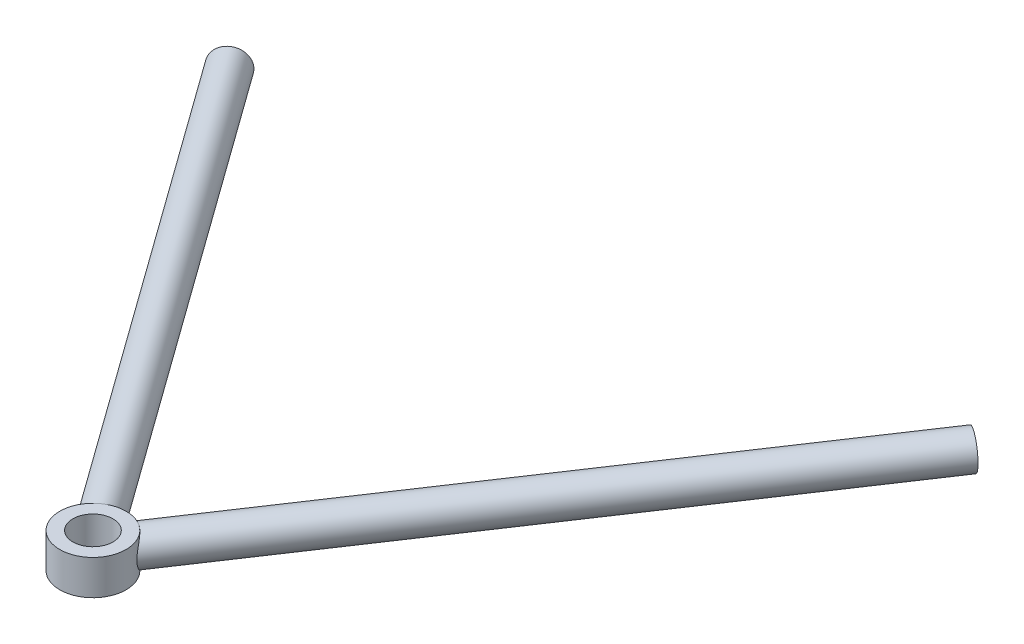
from build123d import *

# Parameters (mm, degrees)
SKETCH1_R                = 19.0062
SKETCH1_R_2              = 11.5062
BOSS_EXTRUDE1_DEPTH      = 10
BOSS_EXTRUDE2_REACH      = 392.082
SKETCH5_R                = 10
SKETCH5_R_2              = 7
BOSS_EXTRUDE3_REACH      = 510.057
BOSS_EXTRUDE3_END_RADIUS = 19.0062
SKETCH6_R                = 10
SKETCH6_R_2              = 7


with BuildPart() as part:
    # Sketch1 → Boss-Extrude1 (new, symmetric)
    with BuildSketch(Plane(origin=(0, 0, 0), x_dir=(1, 0, 0), z_dir=(0, 1, 0))):
        Circle(SKETCH1_R)
        Circle(SKETCH1_R_2, mode=Mode.SUBTRACT)
    extrude(amount=BOSS_EXTRUDE1_DEPTH, both=True)

    # Sketch5 → Boss-Extrude2 (add, up to next)
    with BuildSketch(Plane(origin=(201.884851726, 0, -302.352155823), x_dir=(0.8316479627965052, 0, 0.555303219850581), z_dir=(0.555303219850581, 0, -0.8316479627965052)), mode=Mode.PRIVATE) as boss_extrude2_sk1:
        Circle(SKETCH5_R)
        Circle(SKETCH5_R_2, mode=Mode.SUBTRACT)
    boss_extrude2_tool1 = extrude(boss_extrude2_sk1.sketch, amount=-BOSS_EXTRUDE2_REACH, mode=Mode.PRIVATE) - part.part
    add(boss_extrude2_tool1.solids().sort_by_distance((193.803598, 0, -307.748125))[0])

    # Boss-Extrude3: up to this cylinder (the profile starts outside it)
    boss_extrude3_end = Plane(origin=(0, 0, 0), z_dir=(0, -1, 0)) * Cylinder(BOSS_EXTRUDE3_END_RADIUS, 1059.1264, mode=Mode.PRIVATE)
    # Sketch6 → Boss-Extrude3 (add, up to the surface)
    with BuildSketch(Plane(origin=(-200.97050419, 0, -279.254437795), x_dir=(-0.811662071535183, 0, 0.5841272820466578), z_dir=(-0.5841272820466578, 0, -0.811662071535183)), mode=Mode.PRIVATE) as boss_extrude3_sk1:
        Circle(SKETCH6_R)
        Circle(SKETCH6_R_2, mode=Mode.SUBTRACT)
    boss_extrude3_tool1 = extrude(boss_extrude3_sk1.sketch, amount=-BOSS_EXTRUDE3_REACH, mode=Mode.PRIVATE) - boss_extrude3_end
    add(boss_extrude3_tool1.solids().sort_by_distance((-193.083456, 0, -284.930494))[0])


solid = part.part
